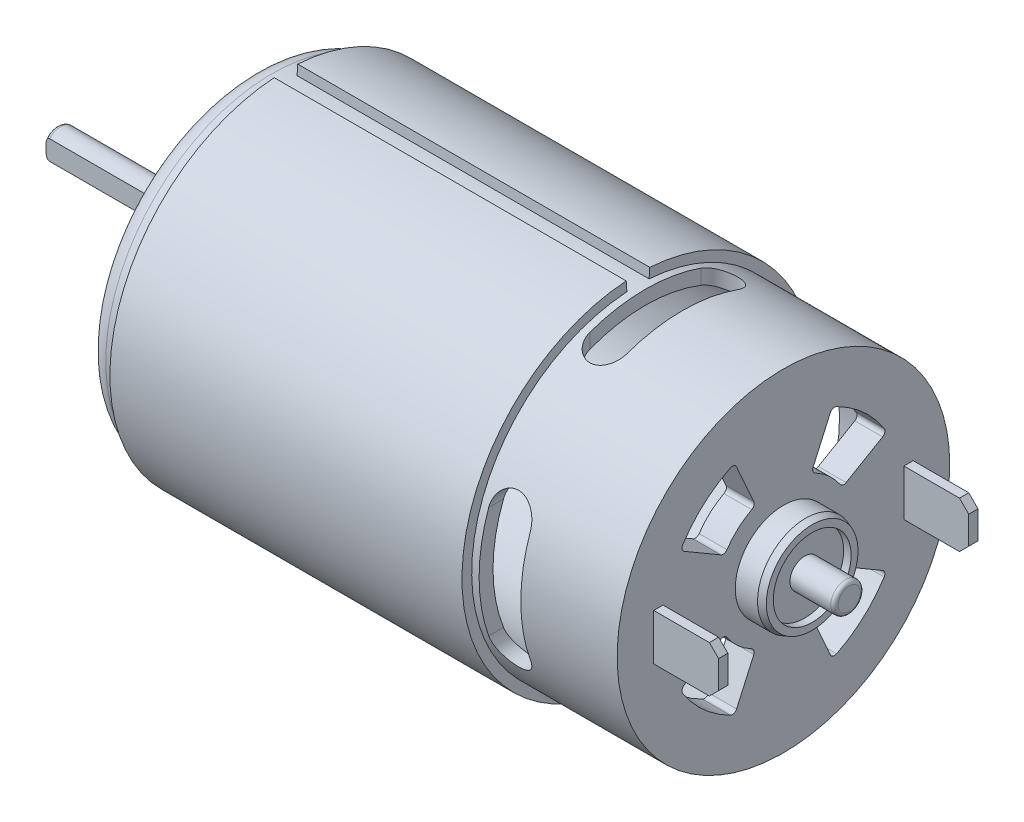
from build123d import *

# Parameters (mm, degrees)
SKETCH_1_R                = 19
EXTRUDE_1_DEPTH           = 57.2
CUT_EXTRUDE_START         = -15.7
SKETCH_2_R                = 19
SKETCH_2_R_2              = 17.95
CUT_EXTRUDE_1_DEPTH       = 15.7
SKETCH_3_R                = 19
SKETCH_3_R_2              = 17.95
CUT_EXTRUDE_2_DEPTH       = 3.5
FILLET_1_R                = 2
CUT_EXTRUDE_3_DEPTH       = 64.196835364
CUT_EXTRUDE_3_DEPTH_BACK  = 64.196835364
CUT_EXTRUDE_4_DEPTH       = 64.196835454
CUT_EXTRUDE_4_DEPTH_BACK  = 64.196835454
SKETCH_6_R                = 6.55
EXTRUDE_2_DEPTH           = 4.5
SKETCH_7_R                = 5.65
CUT_EXTRUDE_5_DEPTH       = 0.8
SKETCH_8_R                = 1.6
EXTRUDE_3_DEPTH           = 17.5
FILLET_2_R                = 0.4
CUT_EXTRUDE_6_DEPTH       = 12.8
CHAMFER_1_SIZE            = 0.7
CHAMFER_1_SIZE2           = 0.254779164
CUT_EXTRUDE_7_DEPTH       = 54.2
SKETCH_11_R               = 1.4
CUT_EXTRUDE_8_DEPTH       = 54.2
CUT_EXTRUDE_9_DEPTH       = 61.047398035
CUT_EXTRUDE_9_DEPTH_BACK  = 61.047398035
CUT_EXTRUDE_10_DEPTH      = 11.9
CUT_EXTRUDE_10_DEPTH_BACK = 41.3
SKETCH_13_R               = 16.45
CUT_EXTRUDE_11_DEPTH      = 3
FILLET_3_R                = 0.5
SKETCH_15_R               = 5.2
EXTRUDE_4_DEPTH           = 3.1
CHAMFER_2_SIZE            = 0.7
CHAMFER_2_SIZE2           = 0.254779164
SKETCH_16_R               = 4.2
CUT_EXTRUDE_12_DEPTH      = 0.8
SKETCH_17_R               = 1.6
EXTRUDE_5_DEPTH           = 4.8
FILLET_4_R                = 0.4
SKETCH_18_W               = 1
SKETCH_18_H               = 5
EXTRUDE_6_DEPTH           = 7
EXTRUDE_6_2_DEPTH         = 7
CHAMFER_3_SIZE            = 1
CHAMFER_4_SIZE            = 1


with BuildPart() as part:
    # Эскиз1 → Бобышка-Вытянуть1 (new body)
    with BuildSketch(Plane(origin=(0, 0, 0), x_dir=(0, 0, -1), z_dir=(1, 0, 0))):
        Circle(SKETCH_1_R)
    extrude(amount=EXTRUDE_1_DEPTH)

    # Эскиз2 → Вырез-Вытянуть1 (cut)
    with BuildSketch(Plane(origin=(57.2, 0, 0), x_dir=(0, 0, -1), z_dir=(1, 0, 0)).offset(CUT_EXTRUDE_START)):
        Circle(SKETCH_2_R)
        Circle(SKETCH_2_R_2, mode=Mode.SUBTRACT)
    extrude(amount=CUT_EXTRUDE_1_DEPTH, mode=Mode.SUBTRACT)

    # Эскиз3 → Вырез-Вытянуть2 (cut)
    with BuildSketch(Plane.ZY):
        Circle(SKETCH_3_R)
        with Locations(Location((0, 0, 0), (0, 0, 180))):
            Circle(SKETCH_3_R_2, mode=Mode.SUBTRACT)
    extrude(amount=-CUT_EXTRUDE_2_DEPTH, mode=Mode.SUBTRACT)

    # Скругление1
    fillet_1_edges = [part.edges().sort_by_distance(p)[0] for p in [
        (0, 0, 17.95),
    ]]
    fillet(fillet_1_edges, radius=FILLET_1_R)

    # Эскиз4 → Вырез-Вытянуть3 (cut, two sides: drawn at the far end of the back side and taken through both)
    with BuildSketch(Plane.XY.offset(-CUT_EXTRUDE_3_DEPTH_BACK)):
        with BuildLine():
            Line((42.3, -6), (42.3, 6))
            ThreePointArc((42.3, 6), (44.55, 8.25), (46.8, 6))
            Line((46.8, 6), (46.8, -6))
            ThreePointArc((46.8, -6), (44.55, -8.25), (42.3, -6))
        make_face()
    extrude(amount=CUT_EXTRUDE_3_DEPTH + CUT_EXTRUDE_3_DEPTH_BACK, mode=Mode.SUBTRACT)

    # Эскиз5 → Вырез-Вытянуть4 (cut, two sides: drawn at the far end of the back side and taken through both)
    with BuildSketch(Plane(origin=(0, 0, 0), x_dir=(1, 0, 0), z_dir=(0, 1, 0)).offset(-CUT_EXTRUDE_4_DEPTH_BACK)):
        with BuildLine():
            Line((46.3, 6), (46.3, -6))
            ThreePointArc((46.3, -6), (44.3, -8), (42.3, -6))
            Line((42.3, -6), (42.3, 6))
            ThreePointArc((42.3, 6), (44.3, 8), (46.3, 6))
        make_face()
    extrude(amount=CUT_EXTRUDE_4_DEPTH + CUT_EXTRUDE_4_DEPTH_BACK, mode=Mode.SUBTRACT)

    # Эскиз6 → Бобышка-Вытянуть2 (add)
    with BuildSketch(Plane.ZY):
        with Locations(Location((0, 0, 0), (0, 0, 180))):
            Circle(SKETCH_6_R)
    extrude(amount=EXTRUDE_2_DEPTH)

    # Эскиз7 → Вырез-Вытянуть5 (cut)
    with BuildSketch(Plane.ZY.offset(4.5)):
        Circle(SKETCH_7_R)
    extrude(amount=-CUT_EXTRUDE_5_DEPTH, mode=Mode.SUBTRACT)

    # Фаска1
    chamfer_1_edges = [part.edges().sort_by_distance(p)[0] for p in [
        (-4.5, 0, 6.55),
    ]]
    chamfer_1_side = [part.faces().sort_by_distance(p)[0] for p in [
        (-2.25, 0, 6.55),
    ]]
    chamfer(chamfer_1_edges, length=CHAMFER_1_SIZE, length2=CHAMFER_1_SIZE2, reference=chamfer_1_side[0])

    # Эскиз10 → Вырез-Вытянуть7 (cut)
    with BuildSketch(Plane.ZY):
        with BuildLine():
            Line((-2.182178902, 11.246692636), (-1.799470822, 9.274260335))
            ThreePointArc((-1.799470822, 9.274260335), (-1.923979699, 8.568772096), (-2.488408675, 8.12759634))
            ThreePointArc((-2.488408675, 8.12759634), (-5.397211319, 6.566590438), (-7.491922344, 4.015108915))
            ThreePointArc((-7.491922344, 4.015108915), (-8.034042055, 3.54679029), (-8.750287228, 3.561246049))
            Line((-8.750287228, 3.561246049), (-10.611281911, 4.318645182))
            ThreePointArc((-10.611281911, 4.318645182), (-11.17184425, 4.8969548), (-11.124260494, 5.700949785))
            ThreePointArc((-11.124260494, 5.700949785), (-7.937075469, 9.656750644), (-3.438989911, 12.017626571))
            ThreePointArc((-3.438989911, 12.017626571), (-2.640997884, 11.908627144), (-2.182178902, 11.246692636))
        make_face()
        with BuildLine():
            Line((-10.611281911, -4.318645182), (-8.750287228, -3.561246049))
            ThreePointArc((-8.750287228, -3.561246049), (-8.034042055, -3.54679029), (-7.491922344, -4.015108915))
            ThreePointArc((-7.491922344, -4.015108915), (-5.397211319, -6.566590438), (-2.488408675, -8.12759634))
            ThreePointArc((-2.488408675, -8.12759634), (-1.923979699, -8.568772096), (-1.799470822, -9.274260335))
            Line((-1.799470822, -9.274260335), (-2.182178902, -11.246692636))
            ThreePointArc((-2.182178902, -11.246692636), (-2.640997884, -11.908627144), (-3.438989911, -12.017626571))
            ThreePointArc((-3.438989911, -12.017626571), (-7.937075469, -9.656750644), (-11.124260494, -5.700949785))
            ThreePointArc((-11.124260494, -5.700949785), (-11.17184425, -4.8969548), (-10.611281911, -4.318645182))
        make_face()
        with BuildLine():
            Line((2.182178902, -11.246692636), (1.799470822, -9.274260335))
            ThreePointArc((1.799470822, -9.274260335), (1.923979699, -8.568772096), (2.488408675, -8.12759634))
            ThreePointArc((2.488408675, -8.12759634), (5.397211319, -6.566590438), (7.491922344, -4.015108915))
            ThreePointArc((7.491922344, -4.015108915), (8.034042055, -3.54679029), (8.750287228, -3.561246049))
            Line((8.750287228, -3.561246049), (10.611281911, -4.318645182))
            ThreePointArc((10.611281911, -4.318645182), (11.17184425, -4.8969548), (11.124260494, -5.700949785))
            ThreePointArc((11.124260494, -5.700949785), (7.937075469, -9.656750644), (3.438989911, -12.017626571))
            ThreePointArc((3.438989911, -12.017626571), (2.640997884, -11.908627144), (2.182178902, -11.246692636))
        make_face()
        with BuildLine():
            Line((2.182178902, 11.246692636), (1.799470822, 9.274260335))
            ThreePointArc((1.799470822, 9.274260335), (1.923979699, 8.568772096), (2.488408675, 8.12759634))
            ThreePointArc((2.488408675, 8.12759634), (5.397211319, 6.566590438), (7.491922344, 4.015108915))
            ThreePointArc((7.491922344, 4.015108915), (8.034042055, 3.54679029), (8.750287228, 3.561246049))
            Line((8.750287228, 3.561246049), (10.611281911, 4.318645182))
            ThreePointArc((10.611281911, 4.318645182), (11.17184425, 4.8969548), (11.124260494, 5.700949785))
            ThreePointArc((11.124260494, 5.700949785), (7.937075469, 9.656750644), (3.438989911, 12.017626571))
            ThreePointArc((3.438989911, 12.017626571), (2.640997884, 11.908627144), (2.182178902, 11.246692636))
        make_face()
    extrude(amount=-CUT_EXTRUDE_7_DEPTH, mode=Mode.SUBTRACT)

    # Эскиз11 → Вырез-Вытянуть8 (cut)
    with BuildSketch(Plane.ZY):
        with Locations(Location((-12.267193006, 0, 0), (0, 0, 180))):
            Circle(SKETCH_11_R)
        with Locations(Location((12.882806994, 0, 0), (0, 0, 180))):
            Circle(SKETCH_11_R)
    extrude(amount=-CUT_EXTRUDE_8_DEPTH, mode=Mode.SUBTRACT)

    # Эскиз12 → Вырез-Вытянуть9 (cut, two sides: drawn at the far end of the back side and taken through both)
    with BuildSketch(Plane.ZY.offset(-3.5).offset(-CUT_EXTRUDE_9_DEPTH_BACK)):
        with BuildLine():
            Line((-1.2, 17.909843662), (-1.270194986, 18.957494684))
            ThreePointArc((-1.270194986, 18.957494684), (0, 19), (1.270194986, 18.957494684))
            Line((1.270194986, 18.957494684), (1.2, 17.909843662))
            ThreePointArc((1.2, 17.909843662), (0, 17.95), (-1.2, 17.909843662))
        make_face()
    extrude(amount=CUT_EXTRUDE_9_DEPTH + CUT_EXTRUDE_9_DEPTH_BACK, mode=Mode.SUBTRACT)

    # Эскиз13 → Вырез-Вытянуть10 (cut, two sides: drawn at the far end of the back side and taken through both)
    with BuildSketch(Plane(origin=(42.3, 0, 0), x_dir=(0, 0, -1), z_dir=(1, 0, 0)).offset(-CUT_EXTRUDE_10_DEPTH_BACK)):
        Circle(SKETCH_13_R)
    extrude(amount=CUT_EXTRUDE_10_DEPTH + CUT_EXTRUDE_10_DEPTH_BACK, mode=Mode.SUBTRACT)

    # Эскиз14 → Вырез-Вытянуть11 (cut)
    with BuildSketch(Plane(origin=(57.2, 0, 0), x_dir=(0, 0, -1), z_dir=(1, 0, 0))):
        with BuildLine():
            Line((5.265306122, -11.77652544), (3, -6.709880774))
            ThreePointArc((3, -6.709880774), (4.910021573, -5.469386451), (6.34860395, -3.703745117))
            Line((6.34860395, -3.703745117), (11.142447748, -6.500450613))
            ThreePointArc((11.142447748, -6.500450613), (8.617588884, -9.599331322), (5.265306122, -11.77652544))
        make_face()
        with BuildLine():
            Line((-11.142447748, -6.500450613), (-6.34860395, -3.703745117))
            ThreePointArc((-6.34860395, -3.703745117), (-4.910021573, -5.469386451), (-3, -6.709880774))
            Line((-3, -6.709880774), (-5.265306122, -11.77652544))
            ThreePointArc((-5.265306122, -11.77652544), (-8.617588884, -9.599331322), (-11.142447748, -6.500450613))
        make_face()
        with BuildLine():
            Line((6.34860395, 3.703745117), (11.142447748, 6.500450613))
            ThreePointArc((11.142447748, 6.500450613), (8.617588884, 9.599331322), (5.265306122, 11.77652544))
            Line((5.265306122, 11.77652544), (3, 6.709880774))
            ThreePointArc((3, 6.709880774), (4.910021573, 5.469386451), (6.34860395, 3.703745117))
        make_face()
        with BuildLine():
            Line((-3, 6.709880774), (-5.265306122, 11.77652544))
            ThreePointArc((-5.265306122, 11.77652544), (-8.617588884, 9.599331322), (-11.142447748, 6.500450613))
            Line((-11.142447748, 6.500450613), (-6.34860395, 3.703745117))
            ThreePointArc((-6.34860395, 3.703745117), (-4.910021573, 5.469386451), (-3, 6.709880774))
        make_face()
    extrude(amount=-CUT_EXTRUDE_11_DEPTH, mode=Mode.SUBTRACT)

    # Скругление3
    # the kernel refuses this fillet: 0.5 mm, written as the material it adds along each edge
    with BuildSketch(Plane(origin=(57.2, -6.709880774, -3), x_dir=(0, -0.9129089488304096, -0.4081632653061231), z_dir=(-1, 0, 0)), Plane(origin=(57.2, -3.703745117, 6.34860395), x_dir=(0, -0.5039109002539841, 0.8637556394057404), z_dir=(-1, 0, 0)), Plane(origin=(57.2, 3.703745117, -6.34860395), x_dir=(0, 0.5039109002539816, -0.8637556394057418), z_dir=(-1, 0, 0))) as fillet_3_piece_1:
        with BuildLine():
            CenterArc((0.48406025, -0.5), FILLET_3_R, 90, 86.34811519)
            ThreePointArc((-0.014924479, -0.468152866), (-0.003732067, -0.234195349), (0, 0))
            Line((0, 0), (0.48406025, 0))
        make_face()
    extrude(amount=3)
    with BuildSketch(Plane(origin=(57.2, -3.703745117, -6.34860395), x_dir=(0, -0.5039109002539852, -0.8637556394057396), z_dir=(-1, 0, 0)), Plane(origin=(57.2, 3.703745117, 6.34860395), x_dir=(0, 0.503910900253985, 0.8637556394057399), z_dir=(-1, 0, 0)), Plane(origin=(57.2, -6.709880774, 3), x_dir=(0, -0.9129089488304104, 0.4081632653061213), z_dir=(-1, 0, 0)), Plane(origin=(57.2, 6.709880774, -3), x_dir=(0, 0.9129089488304103, -0.40816326530612135), z_dir=(-1, 0, 0))) as fillet_3_piece_2:
        with BuildLine():
            CenterArc((0.48406025, 0.5), FILLET_3_R, 183.65188481, 86.34811519)
            ThreePointArc((-0.014924479, 0.468152866), (-0.003732067, 0.234195349), (0, 0))
            Line((0, 0), (0.48406025, 0))
        make_face()
    extrude(amount=3)
    with BuildSketch(Plane(origin=(57.2, -6.500450613, -11.142447748), x_dir=(0, -0.8534184412318403, 0.5212264039411433), z_dir=(-1, 0, 0)), Plane(origin=(57.2, -11.77652544, 5.265306122), x_dir=(0, 0.4264894342183584, 0.9044925441926565), z_dir=(-1, 0, 0)), Plane(origin=(57.2, 11.77652544, -5.265306122), x_dir=(0, -0.4264894342183638, -0.9044925441926539), z_dir=(-1, 0, 0))) as fillet_3_piece_3:
        with BuildLine():
            CenterArc((0.510184387, 0.499898329), FILLET_3_R, 178.844529895, 92.310940209)
            Line((0.010286058, 0.509981024), (0, 0))
            ThreePointArc((0, 0), (0.260133541, -0.002623114), (0.520267083, 0))
        make_face()
    extrude(amount=3)
    with BuildSketch(Plane(origin=(57.2, -11.77652544, -5.265306122), x_dir=(0, 0.9129089488304081, 0.4081632653061266), z_dir=(-1, 0, 0)), Plane(origin=(57.2, 11.77652544, 5.265306122), x_dir=(0, -0.9129089488304105, -0.40816326530612085), z_dir=(-1, 0, 0)), Plane(origin=(57.2, -6.500450613, 11.142447748), x_dir=(0, 0.5039109002539844, -0.8637556394057402), z_dir=(-1, 0, 0)), Plane(origin=(57.2, 6.500450613, -11.142447748), x_dir=(0, -0.5039109002539818, 0.8637556394057417), z_dir=(-1, 0, 0))) as fillet_3_piece_4:
        with BuildLine():
            CenterArc((0.510084746, 0.5), FILLET_3_R, 177.689059791, 92.310940209)
            ThreePointArc((0.010491389, 0.52016129), (0.002623114, 0.260133541), (0, 0))
            Line((0, 0), (0.510084746, 0))
        make_face()
    extrude(amount=3)
    with BuildSketch(Plane(origin=(57.2, 6.709880774, 3), x_dir=(0, -0.43704431798937643, 0.8994399724902161), z_dir=(-1, 0, 0))) as fillet_3_piece_5:
        with BuildLine():
            CenterArc((0.484322355, 0.499746118), FILLET_3_R, 181.825942405, 86.34811519)
            Line((-0.015423763, 0.483814461), (0, 0))
            ThreePointArc((0, 0), (0.234195349, 0.003732067), (0.468390698, 0))
        make_face()
    extrude(amount=3)
    with BuildSketch(Plane(origin=(57.2, 6.500450613, 11.142447748), x_dir=(0, -0.5039109002539842, -0.8637556394057403), z_dir=(-1, 0, 0))) as fillet_3_piece_6:
        with BuildLine():
            CenterArc((0.510084746, -0.5), FILLET_3_R, 90, 92.310940209)
            ThreePointArc((0.010491389, -0.52016129), (0.002623114, -0.260133541), (0, 0))
            Line((0, 0), (0.510084746, 0))
        make_face()
    extrude(amount=3)

    # Эскиз15 → Бобышка-Вытянуть4 (add)
    with BuildSketch(Plane(origin=(57.2, 0, 0), x_dir=(0, 0, -1), z_dir=(1, 0, 0))):
        with Locations(Location((0, 0, 0), (0, 0, 180))):
            Circle(SKETCH_15_R)
    extrude(amount=EXTRUDE_4_DEPTH)

    # Фаска2
    chamfer_2_edges = [part.edges().sort_by_distance(p)[0] for p in [
        (60.3, 0, -5.2),
    ]]
    chamfer_2_side = [part.faces().sort_by_distance(p)[0] for p in [
        (58.75, 0, -5.2),
    ]]
    chamfer(chamfer_2_edges, length=CHAMFER_2_SIZE, length2=CHAMFER_2_SIZE2, reference=chamfer_2_side[0])

    # Эскиз16 → Вырез-Вытянуть12 (cut)
    with BuildSketch(Plane(origin=(60.3, 0, 0), x_dir=(0, 0, -1), z_dir=(1, 0, 0))):
        Circle(SKETCH_16_R)
    extrude(amount=-CUT_EXTRUDE_12_DEPTH, mode=Mode.SUBTRACT)


with BuildPart() as body_2:
    # Эскиз8 → Бобышка-Вытянуть3 (new body)
    with BuildSketch(Plane.ZY.offset(3.7)):
        Circle(SKETCH_8_R)
    extrude(amount=EXTRUDE_3_DEPTH)

    # Скругление2
    fillet_2_edges = [body_2.edges().sort_by_distance(p)[0] for p in [
        (-21.2, 0, -1.6),
    ]]
    fillet(fillet_2_edges, radius=FILLET_2_R)

    # Эскиз9 → Вырез-Вытянуть6 (cut)
    with BuildSketch(Plane.ZY.offset(21.2)):
        with BuildLine():
            Line((1.2, 1.058300524), (1.2, -1.058300524))
            ThreePointArc((1.2, -1.058300524), (1.6, 0), (1.2, 1.058300524))
        make_face()
    extrude(amount=-CUT_EXTRUDE_6_DEPTH, mode=Mode.SUBTRACT)


with BuildPart() as body_3:
    # Эскиз17 → Бобышка-Вытянуть5 (new body)
    with BuildSketch(Plane(origin=(59.5, 0, 0), x_dir=(0, 0, -1), z_dir=(1, 0, 0))):
        Circle(SKETCH_17_R)
    extrude(amount=EXTRUDE_5_DEPTH)

    # Скругление4
    fillet_4_edges = [body_3.edges().sort_by_distance(p)[0] for p in [
        (64.3, 0, 1.6),
    ]]
    fillet(fillet_4_edges, radius=FILLET_4_R)


with BuildPart() as body_4:
    # Эскиз18 → Бобышка-Вытянуть6 (new body)
    with BuildSketch(Plane(origin=(57.2, 0, 0), x_dir=(0, 0, -1), z_dir=(1, 0, 0))):
        with Locations((13.5, -0.131269588)):
            Rectangle(SKETCH_18_W, SKETCH_18_H)
    extrude(amount=EXTRUDE_6_DEPTH)

    # Фаска4
    chamfer_4_edges = [body_4.edges().sort_by_distance(p)[0] for p in [
        (64.2, -2.631269588, -13.5),
        (64.2, 2.368730412, -13.5),
    ]]
    chamfer(chamfer_4_edges, length=CHAMFER_4_SIZE)


with BuildPart() as body_5:
    # Эскиз18 → Extrude 6 2 (new body)
    with BuildSketch(Plane(origin=(57.2, 0, 0), x_dir=(0, 0, -1), z_dir=(1, 0, 0))):
        with Locations((-13.5, -0.131269588)):
            Rectangle(SKETCH_18_W, SKETCH_18_H)
    extrude(amount=EXTRUDE_6_2_DEPTH)

    # Фаска3
    chamfer_3_edges = [body_5.edges().sort_by_distance(p)[0] for p in [
        (64.2, -2.631269588, 13.5),
        (64.2, 2.368730412, 13.5),
    ]]
    chamfer(chamfer_3_edges, length=CHAMFER_3_SIZE)


solid = Compound([part.part, body_2.part, body_3.part, body_4.part, body_5.part])
